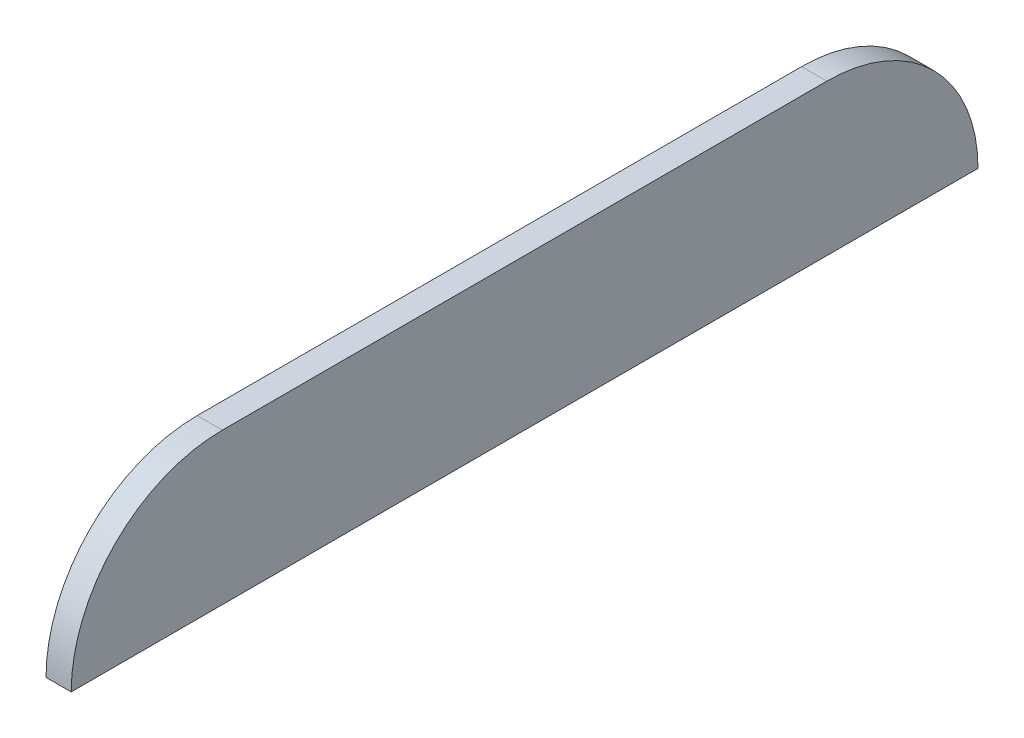
from build123d import *

# Parameters (mm, degrees)
SKETCH1_W           = 114.3
SKETCH1_H           = 19.05
BOSS_EXTRUDE1_DEPTH = 3.175
FILLET1_R           = 19.05


with BuildPart() as part:
    # Sketch1 → Boss-Extrude1 (new body)
    with BuildSketch(Plane(origin=(0, 0, 0), x_dir=(0, 0, -1), z_dir=(1, 0, 0))):
        Rectangle(SKETCH1_W, SKETCH1_H)
    extrude(amount=BOSS_EXTRUDE1_DEPTH)

    # Fillet1
    fillet1_edges = [part.edges().sort_by_distance(p)[0] for p in [
        (1.5875, 9.525, -57.15),
        (1.5875, 9.525, 57.15),
    ]]
    fillet(fillet1_edges, radius=FILLET1_R - 0.0001)  # a hair under: the kernel refuses the full size


solid = part.part
